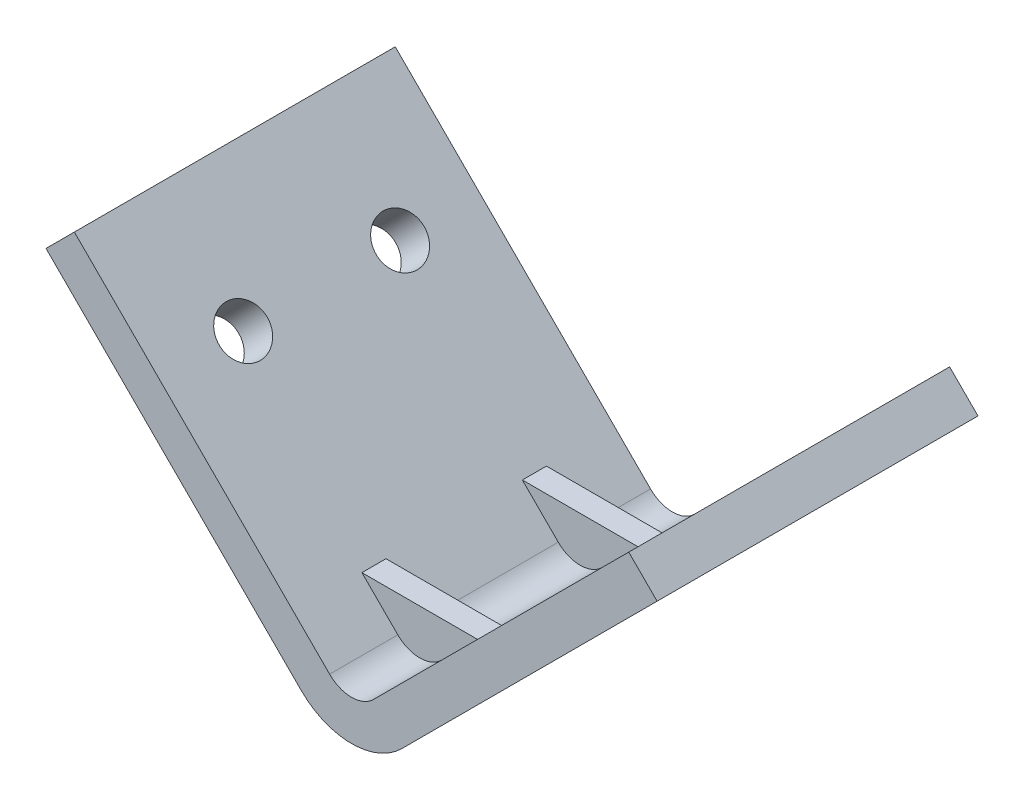
from build123d import *

# Parameters (mm, degrees)
SKETCH3_W           = 100
SKETCH3_H           = 40
SKETCH3_R           = 3
BOSS_EXTRUDE1_DEPTH = 5
FLEX1_START         = -36
FLEX1_OUTLINE_W     = 48.866197724
FLEX1_OUTLINE_H     = 40
FLEX1_DEPTH         = 33.40315081
FLEX1_START_2       = -2.59684919
FLEX1_2_OUTLINE_W   = 48.866197724
FLEX1_2_OUTLINE_H   = 40
FLEX1_2_OUTLINE_R   = 3
FLEX1_2_DEPTH       = 8.866197724
FLEX1_START_3       = 2.448182419
FLEX1_3_OUTLINE_W   = 5
FLEX1_3_OUTLINE_H   = 40
FLEX1_3_DEPTH       = 48.821166115
FLEX1_START_4       = -51.269348534
FLEX1_4_OUTLINE_W   = 3.866197724
FLEX1_4_OUTLINE_H   = 40
FLEX1_4_DEPTH       = 45
FLEX1_START_5       = 2.59684919
FLEX1_5_OUTLINE_R   = 3
FLEX1_5_OUTLINE_W   = 3.821166115
FLEX1_5_OUTLINE_H   = 40
FLEX1_5_DEPTH       = 33.40315081
FLEX1_START_6       = -2.40315081
FLEX1_6_OUTLINE_R   = 3
FLEX1_6_DEPTH       = 5
FLEX1_START_7       = 1.935784603
FLEX1_7_OUTLINE_W   = 0.045031609
FLEX1_7_OUTLINE_H   = 40
FLEX1_7_DEPTH       = 0.545856358
FLEX1_START_8       = -40
FLEX1_8_DEPTH       = 40
BOSS_EXTRUDE2_DEPTH = 1.5


with BuildPart() as part:
    # Sketch3 → Boss-Extrude1 (new body)
    with BuildSketch(Plane(origin=(0, 0, 0), x_dir=(1, 0, 0), z_dir=(0, 1, 0))):
        with Locations((0, 20)):
            Rectangle(SKETCH3_W, SKETCH3_H)
        with Locations(Location((35, 30, 0), (0, 0, 270))):
            Circle(SKETCH3_R, mode=Mode.SUBTRACT)
        with Locations(Location((35, 10.435948304, 0), (0, 0, 270))):
            Circle(SKETCH3_R, mode=Mode.SUBTRACT)
        with Locations(Location((-35, 10.435948304, 0), (0, 0, 90))):
            Circle(SKETCH3_R, mode=Mode.SUBTRACT)
        with Locations(Location((-35, 30, 0), (0, 0, 90))):
            Circle(SKETCH3_R, mode=Mode.SUBTRACT)
    extrude(amount=BOSS_EXTRUDE1_DEPTH)

    # Flex1: read off the stored shape, not the designer's step
    # Flex1 outline → Flex1 (cut)
    with BuildSketch(Plane(origin=(0, 0, 0), x_dir=(0.707106781186546, -0.707106781186549, 0), z_dir=(0.707106781186549, 0.707106781186546, 0)).offset(FLEX1_START)):
        with Locations((-26.836249672, 20)):
            Rectangle(FLEX1_OUTLINE_W, FLEX1_OUTLINE_H)
    extrude(amount=FLEX1_DEPTH, mode=Mode.SUBTRACT)

    # Flex1 2 outline → Flex1 2 (add)
    with BuildSketch(Plane(origin=(0, 0, 0), x_dir=(0.707106781186546, -0.707106781186549, 0), z_dir=(0.707106781186549, 0.707106781186546, 0)).offset(FLEX1_START_2)):
        with Locations((-26.836249672, 20)):
            Rectangle(FLEX1_2_OUTLINE_W, FLEX1_2_OUTLINE_H)
        with Locations((-36.269348534, 10.435948304)):
            Circle(FLEX1_2_OUTLINE_R, mode=Mode.SUBTRACT)
        with Locations((-36.269348534, 30)):
            Circle(FLEX1_2_OUTLINE_R, mode=Mode.SUBTRACT)
    extrude(amount=FLEX1_2_DEPTH)

    # Flex1 3 outline → Flex1 3 (add)
    with BuildSketch(Plane(origin=(0, 0, 0), x_dir=(0.707106781186546, -0.707106781186549, 0), z_dir=(0.707106781186549, 0.707106781186546, 0)).offset(FLEX1_START_3)):
        with Locations((0.09684919, 20)):
            Rectangle(FLEX1_3_OUTLINE_W, FLEX1_3_OUTLINE_H)
    extrude(amount=FLEX1_3_DEPTH)

    # Flex1 4 outline → Flex1 4 (cut)
    with BuildSketch(Plane(origin=(0, 0, 0), x_dir=(0.707106781186546, 0.707106781186549, 0), z_dir=(0.707106781186549, -0.707106781186546, 0)).offset(FLEX1_START_4)):
        with Locations((4.336249672, -20)):
            Rectangle(FLEX1_4_OUTLINE_W, FLEX1_4_OUTLINE_H)
    extrude(amount=FLEX1_4_DEPTH, mode=Mode.SUBTRACT)

    # Flex1 5 outline → Flex1 5 (cut)
    with BuildSketch(Plane(origin=(0, 0, 0), x_dir=(0.707106781186546, 0.707106781186549, 0), z_dir=(0.707106781186549, -0.707106781186546, 0)).offset(FLEX1_START_5)):
        with Locations((36.269348534, -10.435948304)):
            Circle(FLEX1_5_OUTLINE_R)
        with Locations((36.269348534, -30)):
            Circle(FLEX1_5_OUTLINE_R)
        with Locations((4.358765477, -20)):
            Rectangle(FLEX1_5_OUTLINE_W, FLEX1_5_OUTLINE_H)
    extrude(amount=FLEX1_5_DEPTH, mode=Mode.SUBTRACT)

    # Flex1 6 outline → Flex1 6 (cut)
    with BuildSketch(Plane(origin=(0, 0, 0), x_dir=(0.707106781186546, 0.707106781186549, 0), z_dir=(0.707106781186549, -0.707106781186546, 0)).offset(FLEX1_START_6)):
        with Locations((36.269348534, -10.435948304)):
            Circle(FLEX1_6_OUTLINE_R)
        with Locations((36.269348534, -30)):
            Circle(FLEX1_6_OUTLINE_R)
    extrude(amount=FLEX1_6_DEPTH, mode=Mode.SUBTRACT)

    # Flex1 7 outline → Flex1 7 (cut)
    with BuildSketch(Plane(origin=(0, 0, 0), x_dir=(0.707106781186546, 0.707106781186549, 0), z_dir=(0.707106781186549, -0.707106781186546, 0)).offset(FLEX1_START_7)):
        with Locations((2.425666614, -20)):
            Rectangle(FLEX1_7_OUTLINE_W, FLEX1_7_OUTLINE_H)
    extrude(amount=FLEX1_7_DEPTH, mode=Mode.SUBTRACT)

    # Flex1 8 outline → Flex1 8 (cut)
    with BuildSketch(Plane.XY.offset(FLEX1_START_8)):
        with BuildLine():
            ThreePointArc((-2.733814628, 6.132383096), (0, 5), (2.733814628, 6.132383096))
            Line((2.733814628, 6.132383096), (0, 8.866197724))
            Line((0, 8.866197724), (-2.733814628, 6.132383096))
        make_face()
        with BuildLine():
            Line((3.567376062, -0.105123282), (6.269348534, 2.59684919))
            ThreePointArc((6.269348534, 2.59684919), (3.392946977, 0.674899116), (0, 0))
            Line((0, 0), (3.398568468, 0))
            Line((3.398568468, 0), (3.068090654, 0.330477814))
            Line((3.068090654, 0.330477814), (3.09993281, 0.36231997))
            Line((3.09993281, 0.36231997), (3.567376062, -0.105123282))
        make_face()
        with BuildLine():
            Line((-3.398568468, 0), (0, 0))
            ThreePointArc((0, 0), (-3.392946977, 0.674899116), (-6.269348534, 2.59684919))
            Line((-6.269348534, 2.59684919), (-3.535533906, -0.136965438))
            Line((-3.535533906, -0.136965438), (-3.398568468, 0))
        make_face()
        Polygon((8.672499344, 5), (6.269348534, 2.59684919), (8.866197724, 0), (50, 0), (50, 5), align=None)
    extrude(amount=FLEX1_8_DEPTH, mode=Mode.SUBTRACT)

    # Sketch4 → Boss-Extrude2 (add, symmetric)
    with BuildSketch(Plane.XY.offset(-10)):
        Polygon((0, 0), (10.606601718, 10.606601718), (-10.606601718, 10.606601718), align=None)
    boss_extrude2 = extrude(amount=BOSS_EXTRUDE2_DEPTH, both=True)

    # Mirror1: Boss-Extrude2 across plane
    add(boss_extrude2.mirror(Plane.XY.offset(-20)))


solid = part.part
